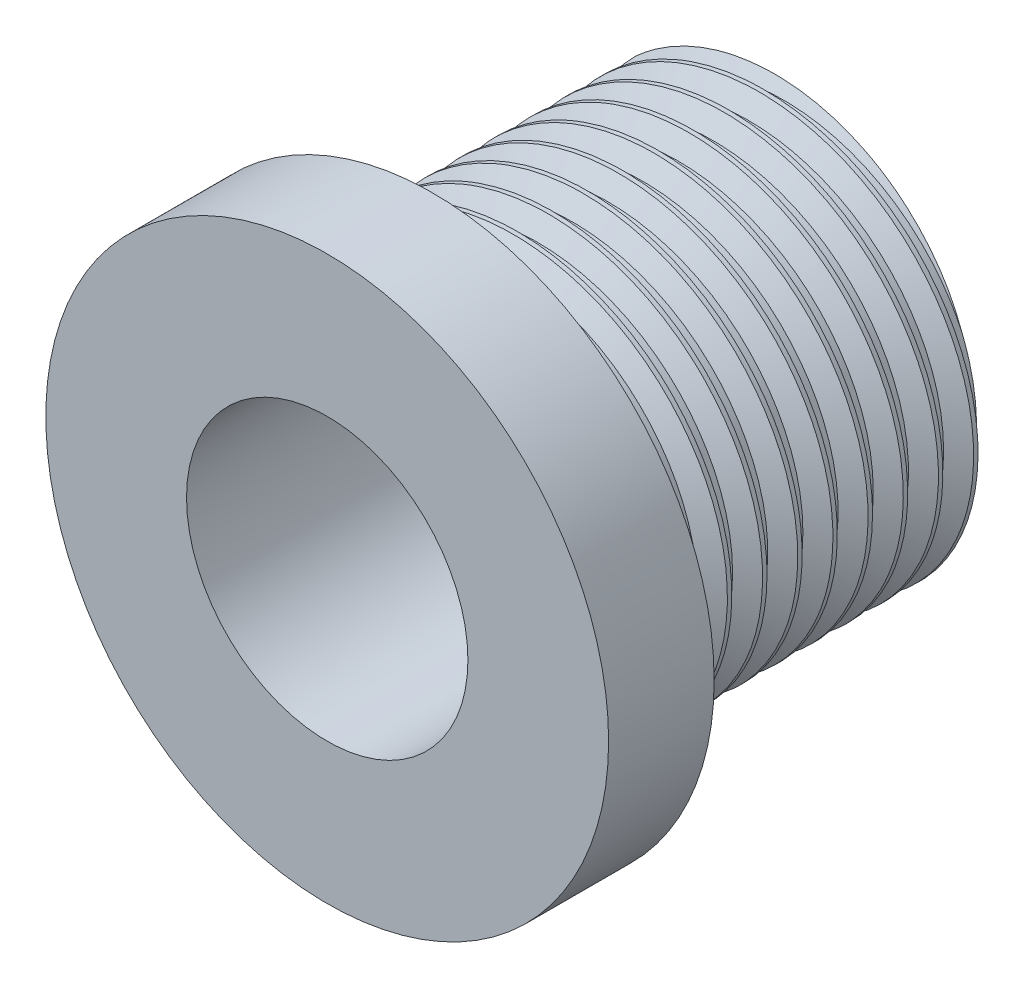
from build123d import *
from build123d.topology import SkipClean

# Parameters (mm, degrees)
SKETCH1_R               = 6
BOSS_EXTRUDE1_DEPTH     = 10
CUT_EXTRUDE1_DEPTH      = 14.114877049
CUT_EXTRUDE1_DEPTH_BACK = 14.114877049
SKETCH2_R               = 4
THREAD1_PITCH           = 1
SKETCH10_R              = 8
BOSS_EXTRUDE2_DEPTH     = 3
CUT_EXTRUDE2_START      = 35
SKETCH2_2_R             = 4
CUT_EXTRUDE2_DEPTH      = 35


with BuildPart() as part:
    # Sketch1 → Boss-Extrude1 (new body)
    with BuildSketch(Plane.XY):
        Circle(SKETCH1_R)
    extrude(amount=BOSS_EXTRUDE1_DEPTH)

    # Sketch2 → Cut-Extrude1 (cut, two sides: drawn at the far end of the back side and taken through both)
    with BuildSketch(Plane.XY.offset(10).offset(-CUT_EXTRUDE1_DEPTH_BACK)):
        Circle(SKETCH2_R)
    extrude(amount=CUT_EXTRUDE1_DEPTH + CUT_EXTRUDE1_DEPTH_BACK, mode=Mode.SUBTRACT)

    # Thread1: the profile of Thread Profile1 profile screwed along a right-hand helix of 10 turns, 8 arcs to a turn; built about Z, then put on its axis
    thread1_z = Axis((0, 0, 0), (0, 0, 1))
    thread1_corners = [(6.0003, 0, -0.000173205), (6.0003, 0, 0.875173202), (5.458734125, 0, 0.562499999), (5.458734125, 0, 0.312499999)]
    with BuildLine(mode=Mode.PRIVATE) as thread1_profile:
        Line(thread1_corners[0], thread1_corners[1])
        Line(thread1_corners[1], thread1_corners[2])
        Line(thread1_corners[2], thread1_corners[3])
        Line(thread1_corners[3], thread1_corners[0])
    thread1_cap = Face(thread1_profile.wire())
    thread1_turn_angles = [0, 22.5, 45, 67.5, 90, 112.5, 135, 157.5, 180, 202.5, 225, 247.5, 270, 292.5, 315, 337.5, 360]
    thread1_turn_weights = [1, 0.9238795325112867, 1, 0.9238795325112867, 1, 0.9238795325112867, 1, 0.9238795325112867, 1, 0.9238795325112867, 1, 0.9238795325112867, 1, 0.9238795325112867, 1, 0.9238795325112867, 1]
    thread1_turn_rails = [Edge.make_bspline([Vector(p[0], p[1], 0).rotate(thread1_z, thread1_turn_angles[k]) / thread1_turn_weights[k] + Vector(0, 0, p[2] + THREAD1_PITCH * thread1_turn_angles[k] / 360) for k in range(17)], [0, 0, 0, 1, 1, 2, 2, 3, 3, 4, 4, 5, 5, 6, 6, 7, 7, 8, 8, 8], 2, thread1_turn_weights) for p in thread1_corners]
    thread1_turn_sides = [Face.make_surface_from_curves(thread1_turn_rails[p[0]], thread1_turn_rails[p[1]]) for p in [(0, 1), (1, 2), (2, 3), (3, 0)]]
    thread1 = Plane(origin=(0, 0, 10), x_dir=(-1, 0, 0), z_dir=(0, 0, -1)) * Solid(Shell([*[p.moved(Location((0, 0, THREAD1_PITCH * i))) for i in range(10) for p in thread1_turn_sides], thread1_cap, thread1_cap.rotate(thread1_z, 3600).moved(Location((0, 0, THREAD1_PITCH * 3600 / 360)))]))
    add(thread1, mode=Mode.SUBTRACT)

    # Sketch10 → Boss-Extrude2 (add)
    with SkipClean():  # the faces are left unmerged after this step: merging them gives an invalid solid
        with BuildSketch(Plane.XY.offset(10)):
            Circle(SKETCH10_R)
        extrude(amount=BOSS_EXTRUDE2_DEPTH)

    # Sketch2<2> → Cut-Extrude2 (cut)
    with SkipClean():  # the faces are left unmerged after this step: merging them gives an invalid solid
        with BuildSketch(Plane.XY.offset(10).offset(CUT_EXTRUDE2_START)):
            Circle(SKETCH2_2_R)
        extrude(amount=-CUT_EXTRUDE2_DEPTH, mode=Mode.SUBTRACT)


solid = part.part
